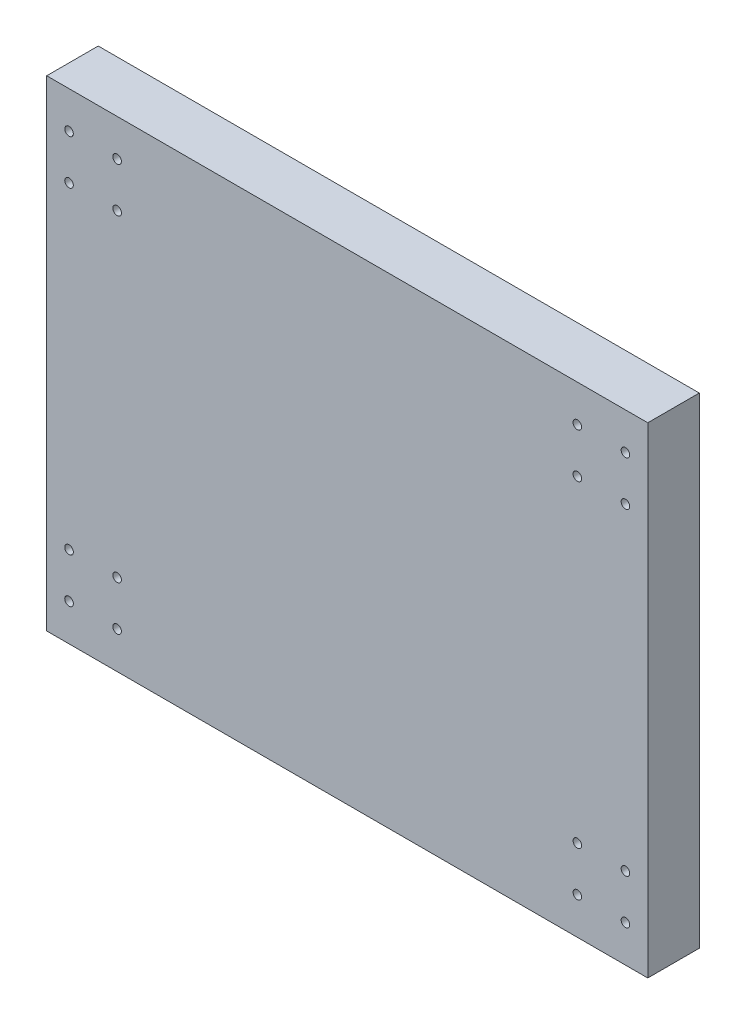
from build123d import *

# Parameters (mm, degrees)
ESQUISSE1_W             = 350
ESQUISSE1_H             = 280
BOSS_EXTRU_1_DEPTH      = 30
ESQUISSE2_R             = 2.5
ENL_V_MAT_EXTRU_1_DEPTH = 450.221548904


with BuildPart() as part:
    # Esquisse1 → Boss.-Extru.1 (new body)
    with BuildSketch(Plane.XY):
        with Locations((175, 140)):
            Rectangle(ESQUISSE1_W, ESQUISSE1_H)
    extrude(amount=BOSS_EXTRU_1_DEPTH)

    # Esquisse2 → Enlèv. mat.-Extru.1 (cut, through all)
    with BuildSketch(Plane.XY.offset(30)):
        with Locations((13, 258.5)):
            Circle(ESQUISSE2_R)
        with Locations((13, 232.5)):
            Circle(ESQUISSE2_R)
        with Locations((41, 232.5)):
            Circle(ESQUISSE2_R)
        with Locations((41, 258.5)):
            Circle(ESQUISSE2_R)
        with Locations((41, 21.5)):
            Circle(ESQUISSE2_R)
        with Locations((41, 47.5)):
            Circle(ESQUISSE2_R)
        with Locations((13, 47.5)):
            Circle(ESQUISSE2_R)
        with Locations((13, 21.5)):
            Circle(ESQUISSE2_R)
        with Locations((337, 21.5)):
            Circle(ESQUISSE2_R)
        with Locations((337, 47.5)):
            Circle(ESQUISSE2_R)
        with Locations((309, 47.5)):
            Circle(ESQUISSE2_R)
        with Locations((309, 21.5)):
            Circle(ESQUISSE2_R)
        with Locations((309, 258.5)):
            Circle(ESQUISSE2_R)
        with Locations((309, 232.5)):
            Circle(ESQUISSE2_R)
        with Locations((337, 232.5)):
            Circle(ESQUISSE2_R)
        with Locations((337, 258.5)):
            Circle(ESQUISSE2_R)
    extrude(amount=-ENL_V_MAT_EXTRU_1_DEPTH, mode=Mode.SUBTRACT)


solid = part.part
